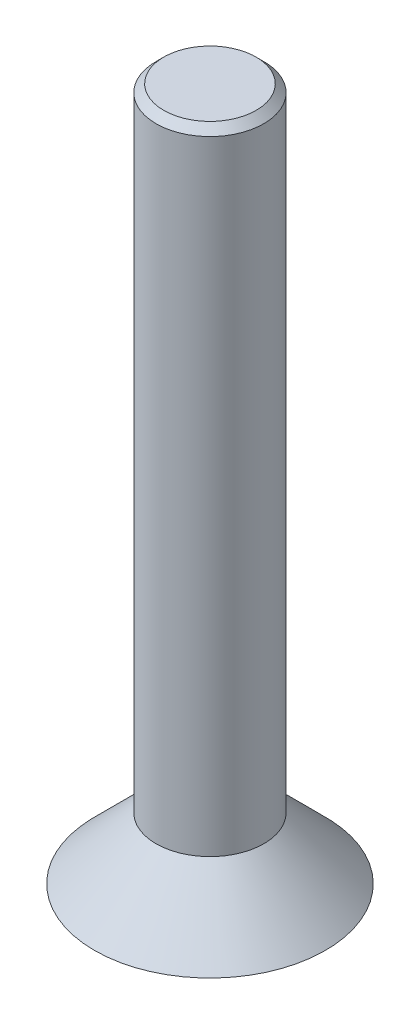
from build123d import *

# Parameters (mm, degrees)
SKETCH_1_R      = 3
EXTRUDE_1_DEPTH = 1.6
CHAMFER_1_SIZE  = 1.6
SKETCH_2_R      = 1.4
EXTRUDE_2_DEPTH = 16.4
CHAMFER_2_SIZE  = 0.2


with BuildPart() as part:
    # 草图1 → 凸台-拉伸1 (new body)
    with BuildSketch(Plane(origin=(0, 0, 0), x_dir=(1, 0, 0), z_dir=(0, 1, 0))):
        with Locations(Location((0, 0, 0), (0, 0, 270))):
            Circle(SKETCH_1_R)
        Polygon((0, -1.154700538), (1, -0.577350269), (1, 0.577350269), (0, 1.154700538), (-1, 0.577350269), (-1, -0.577350269), align=None, mode=Mode.SUBTRACT)
    extrude(amount=EXTRUDE_1_DEPTH)

    # 倒角1
    # the kernel refuses this chamfer: 1.6 mm, written as the material it takes off along each edge
    with BuildSketch(Plane(origin=(0, 1.6, 0), x_dir=(0, 0, 1), z_dir=(-1, 0, 0))) as chamfer_1_piece_1:
        Polygon((3, -CHAMFER_1_SIZE), (3 - CHAMFER_1_SIZE, 0), (3, 0), align=None)
    revolve(axis=Axis((0, 1.6, 0), (0, 1, 0)), mode=Mode.SUBTRACT)

    # 草图2 → 凸台-拉伸2 (add)
    with BuildSketch(Plane(origin=(0, 1.6, 0), x_dir=(1, 0, 0), z_dir=(0, 1, 0))):
        with Locations(Location((0, 0, 0), (0, 0, 270))):
            Circle(SKETCH_2_R)
    extrude(amount=EXTRUDE_2_DEPTH)

    # 倒角2
    chamfer_2_edges = [part.edges().sort_by_distance(p)[0] for p in [
        (0, 18, -1.4),
    ]]
    chamfer(chamfer_2_edges, length=CHAMFER_2_SIZE)


solid = part.part
